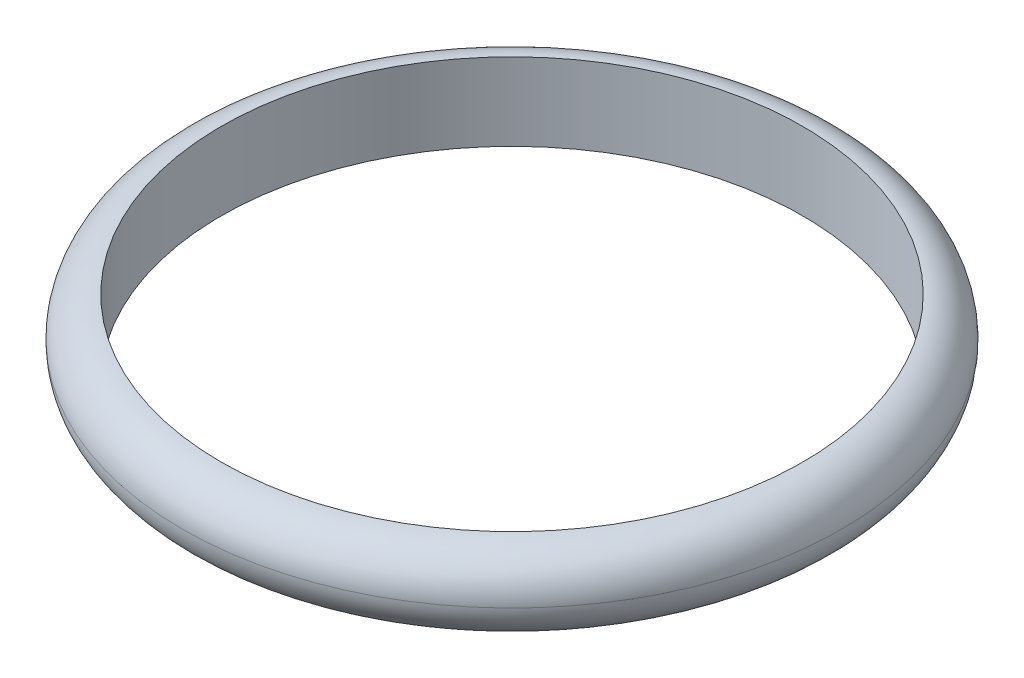
from build123d import *

# Parameters (mm, degrees)
ESQUISSE1_R      = 17
ESQUISSE1_R_2    = 15
EXTRUSION1_DEPTH = 4
CONG_1_R         = 2


with BuildPart() as part:
    # Esquisse1 → Extrusion1 (new body)
    with BuildSketch(Plane(origin=(0, 0, 0), x_dir=(1, 0, 0), z_dir=(0, 1, 0))):
        with Locations(Location((0, 0, 0), (0, 0, 270))):
            Circle(ESQUISSE1_R)
        with Locations(Location((0, 0, 0), (0, 0, 270))):
            Circle(ESQUISSE1_R_2, mode=Mode.SUBTRACT)
    extrude(amount=EXTRUSION1_DEPTH)

    # Congé1
    cong_1_edges = [part.edges().sort_by_distance(p)[0] for p in [
        (0, 0, -17),
        (0, 4, -17),
    ]]
    fillet(cong_1_edges, radius=CONG_1_R - 0.0001)  # a hair under: the kernel refuses the full size


solid = part.part
